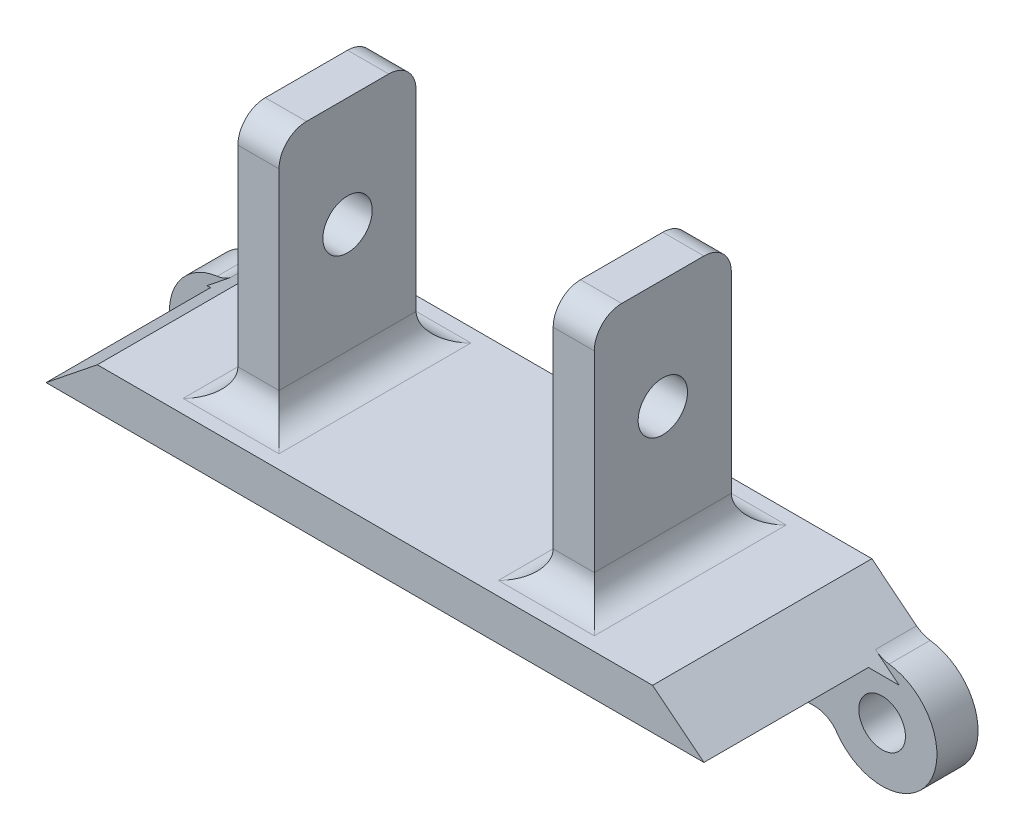
from build123d import *

# Parameters (mm, degrees)
SKETCH_1_R          = 1.7
EXTRUDE_1_DEPTH     = 3
EXTRUDE_2_DEPTH     = 13
EXTRUDE_3_DEPTH     = 18
SKETCH_5_R          = 1.8
CUT_EXTRUDE_1_DEPTH = 34
FILLET_1_R          = 2
CHAMFER_1_SIZE      = 1
FILLET_2_R          = 2


with BuildPart() as part:
    # Эскиз1 → Бобышка-Вытянуть1 (new body)
    with BuildSketch(Plane.XY):
        with BuildLine():
            Line((3.746141591, -1.402292116), (44.253858409, -1.402292116))
            ThreePointArc((44.253858409, -1.402292116), (51.28703274, -2.279345469), (48, 4))
            Line((48, 4), (44.253858409, 7))
            Line((44.253858409, 7), (3.746141591, 7))
            Line((3.746141591, 7), (0, 4))
            ThreePointArc((0, 4), (-3.28703274, -2.279345469), (3.746141591, -1.402292116))
        make_face()
        Circle(SKETCH_1_R, mode=Mode.SUBTRACT)
        with Locations((48, 0)):
            Circle(SKETCH_1_R, mode=Mode.SUBTRACT)
    extrude(amount=EXTRUDE_1_DEPTH)

    # Эскиз2 → Бобышка-Вытянуть2 (add)
    with BuildSketch(Plane.XY.offset(3)):
        Polygon((0, 4), (48, 4), (44.253858409, 7), (3.746141591, 7), align=None)
    extrude(amount=EXTRUDE_2_DEPTH)

    # Эскиз4 → Бобышка-Вытянуть3 (add)
    with BuildSketch(Plane(origin=(0, 7, 0), x_dir=(1, 0, 0), z_dir=(0, 1, 0))):
        Polygon((11, -13), (14, -13), (14, -8), (14, -3), (11, -3), align=None)
        Polygon((34, -8), (34, -3), (37, -3), (37, -13), (34, -13), align=None)
    extrude(amount=EXTRUDE_3_DEPTH)

    # Эскиз5 → Вырез-Вытянуть1 (cut)
    with BuildSketch(Plane.ZY.offset(-11)):
        with Locations(Location((8, 17, 0), (0, 0, 270))):
            Circle(SKETCH_5_R)
    extrude(amount=-CUT_EXTRUDE_1_DEPTH, mode=Mode.SUBTRACT)

    # Скругление1
    fillet_1_edges = [part.edges().sort_by_distance(p)[0] for p in [
        (12.5, 7, 13),
        (14, 7, 8),
        (12.5, 7, 3),
        (11, 7, 8),
        (12.5, 25, 13),
        (12.5, 25, 3),
        (35.5, 25, 13),
        (35.5, 25, 3),
        (34, 7, 8),
        (35.5, 7, 3),
        (37, 7, 8),
        (35.5, 7, 13),
    ]]
    fillet(fillet_1_edges, radius=FILLET_1_R)

    # Фаска1
    # the kernel refuses this chamfer: 1 mm, written as the material it adds along each edge
    with BuildSketch(Plane(origin=(-2.571682988, 4, 3), x_dir=(0, 0.027495876610586053, 0.9996219169112968), z_dir=(1, 0, 0))) as chamfer_1_piece_1_section:
        Polygon((CHAMFER_1_SIZE * 0.999621916911, CHAMFER_1_SIZE * 0.0274958766106), (-CHAMFER_1_SIZE * 0.0274958766106, CHAMFER_1_SIZE * 0.999621916911), (0, 0), align=None)
    chamfer_1_piece_1 = extrude(amount=53.143365976, mode=Mode.PRIVATE)
    chamfer_1_piece_1 = split(chamfer_1_piece_1, bisect_by=Plane(origin=(19.332961003, 26.957252121, 3.279224906), z_dir=(-0.6250871381508221, -0.7805549754619563, 0)), keep=Keep.TOP, mode=Mode.PRIVATE)
    chamfer_1_piece_1 = split(chamfer_1_piece_1, bisect_by=Plane(origin=(0.14685454, 4.117604636, 3.279224906), z_dir=(0.625087138150823, -0.7805549754619556, 0)), keep=Keep.TOP, mode=Mode.PRIVATE)
    add(chamfer_1_piece_1)

    # Скругление2
    fillet_2_edges = [part.edges().sort_by_distance(p)[0] for p in [
        (0, 4, 1.5),
        (48, 4, 1.5),
        (44.253858409, -1.402292116, 1.5),
        (3.746141591, -1.402292116, 1.5),
    ]]
    fillet(fillet_2_edges, radius=FILLET_2_R)


solid = part.part
